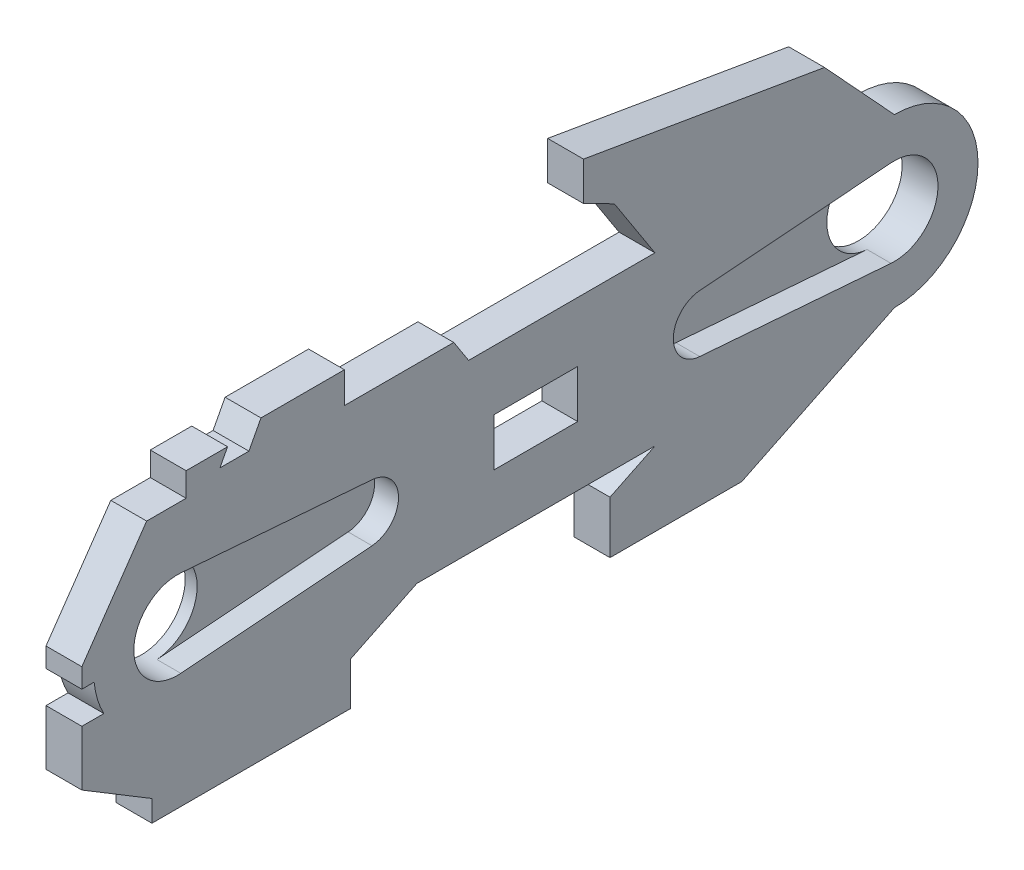
from build123d import *
from build123d.topology import SkipClean

# Parameters (mm, degrees)
BOSS_EXTRUDE1_DEPTH      = 7
BOSS_EXTRUDE1_DEPTH_BACK = 7
SKETCH3_R                = 7
BOSS_EXTRUDE2_DEPTH      = 3
CUT_EXTRUDE1_DEPTH       = 23
CUT_EXTRUDE1_DEPTH_BACK  = 23
SKETCH4_R                = 4
BOSS_EXTRUDE3_DEPTH      = 3
CUT_EXTRUDE2_DEPTH       = 20
CUT_EXTRUDE2_DEPTH_BACK  = 30
SKETCH6_W                = 36.146068324
SKETCH6_H                = 79.881394618
SKETCH7_W                = 6
SKETCH7_H                = 2
BOSS_EXTRUDE4_DEPTH      = 25
SKETCH8_R                = 1.5
CUT_EXTRUDE3_DEPTH       = 25
SKETCH9_W                = 6
SKETCH9_H                = 2
BOSS_EXTRUDE5_DEPTH      = 11
SKETCH10_R               = 4
SKETCH10_R_2             = 3.65
BOSS_EXTRUDE7_DEPTH      = 3
SKETCH11_R               = 2.4
CUT_EXTRUDE4_DEPTH       = 3
BOSS_EXTRUDE9_START      = -1
SKETCH13_W               = 69.204545587
SKETCH13_H               = 9.322892152
SKETCH13_R               = 3.65
BOSS_EXTRUDE9_DEPTH      = 1
SKETCH14_W               = 11.115756027
SKETCH14_H               = 43.925164946
CUT_EXTRUDE5_DEPTH       = 31
CUT_EXTRUDE6_DEPTH       = 22
SKETCH16_W               = 30.440127373
SKETCH16_H               = 8.446463946
CUT_EXTRUDE7_DEPTH       = 10
SKETCH17_W               = 7
SKETCH17_H               = 4
CUT_EXTRUDE8_DEPTH       = 10


with BuildPart() as part:
    # Sketch2 → Boss-Extrude1 (new, two sides: drawn at the far end of the back side and taken through both)
    with BuildSketch(Plane(origin=(0, 0, 0), x_dir=(1, 0, 0), z_dir=(0, 1, 0)).offset(-BOSS_EXTRUDE1_DEPTH_BACK)):
        Polygon((12, 30), (12, -30), (9, -30), (9, -1.5), (-9, -1.5), (-9, -30), (-12, -30), (-12, 30), (-9, 30), (-9, 1.5), (9, 1.5), (9, 30), align=None)
    extrude(amount=BOSS_EXTRUDE1_DEPTH + BOSS_EXTRUDE1_DEPTH_BACK)

    # Sketch3 → Boss-Extrude2 (add)
    with BuildSketch(Plane(origin=(12, 0, 0), x_dir=(0, 0, -1), z_dir=(1, 0, 0))):
        with Locations((-30, 0)):
            Circle(SKETCH3_R)
        with Locations((30, 0)):
            Circle(SKETCH3_R)
    boss_extrude2 = extrude(amount=-BOSS_EXTRUDE2_DEPTH)

    # Mirror1: Boss-Extrude2 across plane
    add(boss_extrude2.mirror(Plane.ZY))

    # Sketch4 → Cut-Extrude1 (cut, two sides: drawn at the far end of the back side and taken through both)
    with BuildSketch(Plane.ZY.offset(-CUT_EXTRUDE1_DEPTH_BACK)):
        with Locations(Location((-30, 0, 0), (0, 0, 180))):
            Circle(SKETCH4_R)
        with Locations(Location((30, 0, 0), (0, 0, 180))):
            Circle(SKETCH4_R)
    extrude(amount=CUT_EXTRUDE1_DEPTH + CUT_EXTRUDE1_DEPTH_BACK, mode=Mode.SUBTRACT)

    # Sketch5 → Boss-Extrude3 (add)
    with BuildSketch(Plane.ZY.offset(12)):
        Polygon((-30, 7), (-24.155374342, 13.339180653), (-3.984430585, 16.782248387), (-3.984430585, 13.558363221), (-6.564031008, 12.252853794), (-9.961076462, 7), align=None)
        Polygon((5.630173652, 7), (6.872920148, 8.921659787), (16.024340395, 8.921659787), (16.024340395, 11.520201473), (23.010764714, 11.520201473), (24.017423371, 9.614604237), (26.442728945, 9.614604237), (25.802127981, 10.827257024), (33.625376893, 10.827257024), (39.584451678, 2.208760433), (39.584451678, -0.649635421), (35.450408088, -0.649635421), (35.450408088, 3.248177107), (30.561687085, 6.409736158), (5.630173652, 6.409736158), align=None)
        Polygon((-30, -7), (-17.229678236, -13.21512033), (-6.200995871, -13.21512033), (-6.200995871, -8.829973728), (-9.961076462, -7), align=None)
        Polygon((9.961076462, -7), (15.524820582, -9.707789187), (15.524820582, -13.295871625), (32.135298846, -13.295871625), (32.135298846, -11.501830406), (39.584451678, -7), (39.584451678, -3.334795163), (35.450408088, -3.334795163), (31.744983073, -5.574136385), (9.961076462, -5.574136385), align=None)
    boss_extrude3 = extrude(amount=-BOSS_EXTRUDE3_DEPTH)

    # Mirror2: Boss-Extrude3 across plane
    add(boss_extrude3.mirror(Plane.ZY))

    # Sketch6 → Cut-Extrude2 (cut, two sides: drawn at the far end of the back side and taken through both)
    with BuildSketch(Plane(origin=(0, 7, 0), x_dir=(1, 0, 0), z_dir=(0, 1, 0)).offset(-CUT_EXTRUDE2_DEPTH_BACK)):
        with Locations((9.073034162, -2.940697309)):
            Rectangle(SKETCH6_W, SKETCH6_H)
    extrude(amount=CUT_EXTRUDE2_DEPTH + CUT_EXTRUDE2_DEPTH_BACK, mode=Mode.SUBTRACT)

    # Sketch7 → Boss-Extrude4 (add)
    with BuildSketch(Plane.ZY.offset(12)):
        with Locations((0, -2)):
            Rectangle(SKETCH7_W, SKETCH7_H)
    extrude(amount=BOSS_EXTRUDE4_DEPTH)

    # Sketch8 → Cut-Extrude3 (cut)
    with BuildSketch(Plane(origin=(0, -1, 0), x_dir=(1, 0, 0), z_dir=(0, 1, 0))):
        with Locations(Location((-34, 0, 0), (0, 0, 270))):
            Circle(SKETCH8_R)
        with Locations(Location((-26, 0, 0), (0, 0, 270))):
            Circle(SKETCH8_R)
    extrude(amount=-CUT_EXTRUDE3_DEPTH, mode=Mode.SUBTRACT)

    # Sketch9 → Boss-Extrude5 (add)
    with BuildSketch(Plane.ZY.offset(12)):
        Rectangle(SKETCH9_W, SKETCH9_H)
    extrude(amount=BOSS_EXTRUDE5_DEPTH)

    # Sketch10 → Boss-Extrude7 (add)
    # profile 1 of 2: a face of its own
    with BuildSketch(Plane(origin=(-9, 0, 0), x_dir=(0, 0, -1), z_dir=(1, 0, 0))):
        with Locations((-30, 0)):
            Circle(SKETCH10_R)
        with Locations((-30, 0)):
            Circle(SKETCH10_R_2, mode=Mode.SUBTRACT)
    # profile 2 of 2: a face of its own
    with BuildSketch(Plane(origin=(-9, 0, 0), x_dir=(0, 0, -1), z_dir=(1, 0, 0))):
        with Locations((30, 0)):
            Circle(SKETCH10_R)
        with Locations((30, 0)):
            Circle(SKETCH10_R_2, mode=Mode.SUBTRACT)
    extrude(amount=-BOSS_EXTRUDE7_DEPTH)

    # Sketch11 → Cut-Extrude4 (cut)
    with BuildSketch(Plane(origin=(-9, 0, 0), x_dir=(0, 0, -1), z_dir=(1, 0, 0))):
        with BuildLine():
            Line((-13.713664596, 2.392755549), (-29.716614907, 3.638982397))
            ThreePointArc((-29.716614907, 3.638982397), (-27.320741186, 2.478723907), (-26.35, 0))
            ThreePointArc((-26.35, 0), (-27.320741186, -2.478723907), (-29.716614907, -3.638982397))
            Line((-29.716614907, -3.638982397), (-13.713664596, -2.392755549))
            ThreePointArc((-13.713664596, -2.392755549), (-16.3, 0), (-13.713664596, 2.392755549))
        make_face()
        with Locations((-13.9, 0)):
            Circle(SKETCH11_R)
        with BuildLine():
            Line((29.716614907, 3.638982397), (13.713664596, 2.392755549))
            ThreePointArc((13.713664596, 2.392755549), (15.529845856, 1.761704426), (16.3, 0))
            ThreePointArc((16.3, 0), (15.529845856, -1.761704426), (13.713664596, -2.392755549))
            Line((13.713664596, -2.392755549), (29.716614907, -3.638982397))
            ThreePointArc((29.716614907, -3.638982397), (26.35, 0), (29.716614907, 3.638982397))
        make_face()
        with Locations((13.9, 0)):
            Circle(SKETCH11_R)
    extrude(amount=-CUT_EXTRUDE4_DEPTH, mode=Mode.SUBTRACT)

    # Sketch13 → Boss-Extrude9 (add)
    with SkipClean():  # the faces are left unmerged after this step: merging them gives an invalid solid
        with BuildSketch(Plane.ZY.offset(12).offset(BOSS_EXTRUDE9_START)):
            with Locations((0.485437096, -0.184140285)):
                Rectangle(SKETCH13_W, SKETCH13_H)
            with Locations(Location((-30, 0, 0), (0, 0, 85.547088609))):
                Circle(SKETCH13_R, mode=Mode.SUBTRACT)
            with Locations(Location((30, 0, 0), (0, 0, 265.547088609))):
                Circle(SKETCH13_R, mode=Mode.SUBTRACT)
        extrude(amount=BOSS_EXTRUDE9_DEPTH)
    add(part.part.scale(1), mode=Mode.REPLACE)  # the faces are merged on a copy

    # Sketch14 → Cut-Extrude5 (cut)
    with BuildSketch(Plane(origin=(-9, 0, 0), x_dir=(0, 0, -1), z_dir=(1, 0, 0))):
        with Locations((-43.557878014, -0.721999448)):
            Rectangle(SKETCH14_W, SKETCH14_H)
    extrude(amount=-CUT_EXTRUDE5_DEPTH, mode=Mode.SUBTRACT)

    # Sketch15 → Cut-Extrude6 (cut)
    with BuildSketch(Plane(origin=(-9, 0, 0), x_dir=(0, 0, -1), z_dir=(1, 0, 0))):
        Polygon((-39.300223418, -0.896828093), (-32.576713138, 8.827257024), (-29.273128497, 8.827257024), (-29.273128497, 11.015866037), (-39.300223418, 11.015866037), align=None)
    extrude(amount=-CUT_EXTRUDE6_DEPTH, mode=Mode.SUBTRACT)

    # Sketch16 → Cut-Extrude7 (cut)
    with BuildSketch(Plane(origin=(0, 1, 0), x_dir=(1, 0, 0), z_dir=(0, 1, 0))):
        with Locations((-27.220063687, 1.223231973)):
            Rectangle(SKETCH16_W, SKETCH16_H)
    extrude(amount=-CUT_EXTRUDE7_DEPTH, mode=Mode.SUBTRACT)

    # Sketch17 → Cut-Extrude8 (cut)
    with BuildSketch(Plane.ZY.offset(12)):
        Rectangle(SKETCH17_W, SKETCH17_H)
    extrude(amount=-CUT_EXTRUDE8_DEPTH, mode=Mode.SUBTRACT)


solid = part.part
